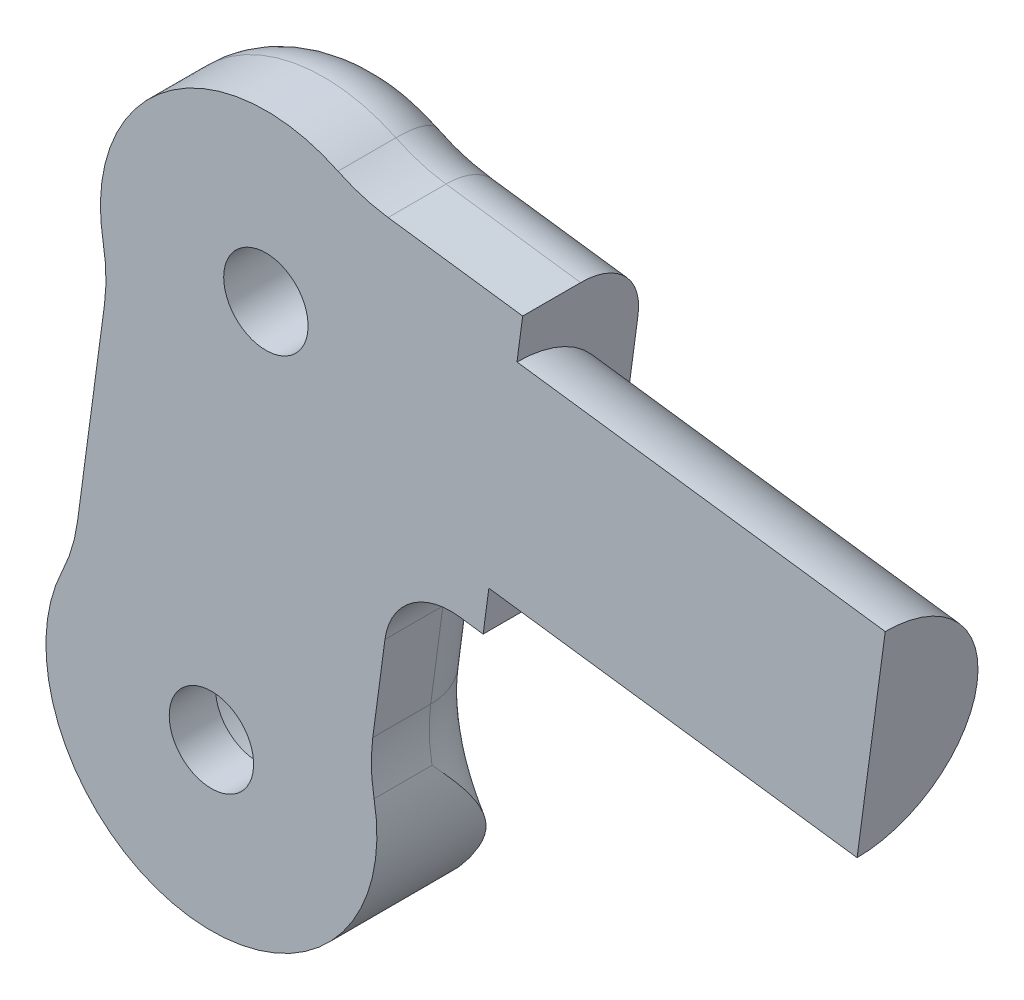
from build123d import *

# Parameters (mm, degrees)
SKETCH_5_R          = 2.549999999999386
SKETCH_5_R_2        = 2.5499999999993856
EXTRUDE_3_DEPTH     = 15
FILLET_4_R          = 4
SKETCH_6_R          = 6.4
EXTRUDE_4_DEPTH     = 22.45
SKETCH_7_R          = 6.500000000000399
CUT_EXTRUDE_1_DEPTH = 4.7
CUT_EXTRUDE_START   = -4.7
SKETCH_8_R          = 6.5000000000004
CUT_EXTRUDE_2_DEPTH = 4.7
SKETCH_9_W          = 7.500000000000001
SKETCH_9_H          = 50
CUT_EXTRUDE_3_DEPTH = 60.93846709540564
CUT_EXTRUDE_4_DEPTH = 1.5


with BuildPart() as part:
    # 草图5 → 凸台-拉伸3 (new body)
    with BuildSketch(Plane.XY):
        with BuildLine():
            Line((15.516814200942974, 7.002212297082977), (7.384422843001557, 8.091371903180063))
            ThreePointArc((7.384422843001557, 8.091371903180063), (5.833974336981676, 8.425935572547054), (4.355928265143314, 9.001438160032777))
            ThreePointArc((4.355928265143314, 9.001438160032777), (-6.069854623087594, 7.9471293467862205), (-9.830420232039064, -1.833804259316535))
            ThreePointArc((-9.830420232039064, -1.833804259316535), (-9.664128327097558, -3.411197812311804), (-9.749336047196284, -4.9950422059047135))
            Line((-9.749336047196284, -4.9950422059047135), (-11.383433357070604, -17.19630156804213))
            ThreePointArc((-11.383433357070604, -17.19630156804213), (-11.717997026437386, -18.74675007406113), (-12.293499613922735, -20.224796145898665))
            ThreePointArc((-12.293499613922735, -20.224796145898665), (-4.619495141172904, -34.49222882793015), (6.538358778190678, -22.74692015173956))
            ThreePointArc((6.538358778190678, -22.74692015173956), (6.372066873248224, -21.169526598736233), (6.457274593312704, -19.585682205136127))
            Line((6.457274593312704, -19.585682205136127), (7.194690181736359, -14.079646060494996))
            ThreePointArc((7.194690181736359, -14.079646060494996), (8.731350099253188, -11.431767796690654), (11.6902654233994, -10.646017768651808))
            Line((11.6902654233994, -10.646017768651808), (13.127433563848712, -10.83849565330608))
            Line((13.127433563848712, -10.83849565330608), (15.516814200942974, 7.002212297082977))
        make_face()
        Circle(SKETCH_5_R, mode=Mode.SUBTRACT)
        with Locations((-3.292061453885612, -24.580724411045196)):
            Circle(SKETCH_5_R_2, mode=Mode.SUBTRACT)
    extrude(amount=EXTRUDE_3_DEPTH)

    # 圆角4
    # the kernel refuses this fillet: 4 mm, written as the material it takes off along each edge
    with BuildSketch(Plane(origin=(-19.660840464079456, -3.667608518633336, 15), x_dir=(0.9830420232040514, 0.18338042593168238, 0), z_dir=(-0.18338042593168238, 0.9830420232040514, 0))) as fillet_4_piece_1:
        with BuildLine():
            CenterArc((9.999999999999877 + FILLET_4_R, FILLET_4_R), FILLET_4_R, 180, 90)
            Line((9.999999999999877 + FILLET_4_R, 0), (9.999999999999877, 0))
            Line((9.999999999999877, 0), (9.999999999999877, FILLET_4_R))
        make_face()
    revolve(axis=Axis((-19.660840464079456, -3.667608518633336, 15), (0, 0, -1)), revolution_arc=18.194872338749263, mode=Mode.SUBTRACT)
    with BuildSketch(Plane(origin=(25.428318617827628, 5.674778609821737, 0), x_dir=(0, 0, 1), z_dir=(-0.9911504416884656, 0.132743368726124, 0))) as fillet_4_piece_2:
        with BuildLine():
            CenterArc((FILLET_4_R, -FILLET_4_R), FILLET_4_R, 90, 90)
            Line((-4.4e-16, -FILLET_4_R), (0, 0))
            Line((0, 0), (FILLET_4_R, 0))
        make_face()
    extrude(amount=18.20500200160084, mode=Mode.SUBTRACT)
    with BuildSketch(Plane(origin=(11.6902654233994, -10.646017768651808, 0), x_dir=(0, 0, 1), z_dir=(0.9911504416883519, -0.13274336872697298, 0))) as fillet_4_piece_3:
        with BuildLine():
            CenterArc((FILLET_4_R, -FILLET_4_R), FILLET_4_R, 90, 90)
            Line((-4.4e-16, -FILLET_4_R), (0, 0))
            Line((0, 0), (FILLET_4_R, 0))
        make_face()
    extrude(amount=11.450000000001213, mode=Mode.SUBTRACT)
    with BuildSketch(Plane(origin=(11.159291948489525, -14.61061953540499, 0), x_dir=(-0.9911504416882816, 0.13274336872749704, 0), z_dir=(-0.13274336872749704, -0.9911504416882816, 0))) as fillet_4_piece_4:
        with BuildLine():
            CenterArc((4.00000000000004 + FILLET_4_R, -FILLET_4_R), FILLET_4_R, 90, 90)
            Line((4.00000000000004 + FILLET_4_R, 4.4e-16), (4.00000000000004, 0))
            Line((4.00000000000004, 0), (4.00000000000004, -FILLET_4_R))
        make_face()
    revolve(axis=Axis((11.159291948489525, -14.61061953540499, 0), (0, 0, -1)), revolution_arc=89.99999999999828, mode=Mode.SUBTRACT)
    with BuildSketch(Plane(origin=(6.457274593312704, -19.585682205136127, 0), x_dir=(0, 0, 1), z_dir=(0.13274336872730183, 0.9911504416883078, 0))) as fillet_4_piece_5:
        with BuildLine():
            CenterArc((FILLET_4_R, -FILLET_4_R), FILLET_4_R, 90, 90)
            Line((-4.4e-16, -FILLET_4_R), (0, 0))
            Line((0, 0), (FILLET_4_R, 0))
        make_face()
    extrude(amount=5.555197186072226, mode=Mode.SUBTRACT)
    with BuildSketch(Plane(origin=(16.3687790116358, -20.91311589226998, 0), x_dir=(-0.3768153606688204, -0.9262883913576953, 0), z_dir=(0.9262883913576953, -0.3768153606688204, 0))) as fillet_4_piece_6:
        with BuildLine():
            CenterArc((10.000000001408804 + FILLET_4_R, -FILLET_4_R), FILLET_4_R, 90, 90)
            Line((10.000000001408804 + FILLET_4_R, 4.4e-16), (10.000000001408804, 0))
            Line((10.000000001408804, 0), (10.000000001408807, -FILLET_4_R))
        make_face()
    revolve(axis=Axis((16.3687790116358, -20.91311589226998, 0), (0, 0, -1)), revolution_arc=75.49159227711695, mode=Mode.SUBTRACT)
    with BuildSketch(Plane(origin=(-9.749336047196284, -4.9950422059047135, 15), x_dir=(0, 0, -1), z_dir=(-0.13274336872713738, -0.9911504416883298, 0))) as fillet_4_piece_7:
        with BuildLine():
            CenterArc((FILLET_4_R, FILLET_4_R), FILLET_4_R, 180, 90)
            Line((0, FILLET_4_R), (0, 0))
            Line((0, 0), (FILLET_4_R, 0))
        make_face()
    extrude(amount=12.310199187677041, mode=Mode.SUBTRACT)
    with BuildSketch(Plane(origin=(-21.29493777395568, -15.868867880738112, 0), x_dir=(0.9911504416879034, -0.132743368730321, 0), z_dir=(0.132743368730321, 0.9911504416879034, 0))) as fillet_4_piece_8:
        with BuildLine():
            CenterArc((10.000000000006096 + FILLET_4_R, -FILLET_4_R), FILLET_4_R, 90, 90)
            Line((10.000000000006096 + FILLET_4_R, 4.4e-16), (10.000000000006096, 0))
            Line((10.000000000006096, 0), (10.000000000006095, -FILLET_4_R))
        make_face()
    revolve(axis=Axis((-21.29493777395568, -15.868867880738112, 0), (0, 0, -1)), revolution_arc=75.49159228762214, mode=Mode.SUBTRACT)
    with BuildSketch(Plane(origin=(-9.749336047196284, -4.9950422059047135, 0), x_dir=(0, 0, 1), z_dir=(-0.13274336872713738, -0.9911504416883298, 0))) as fillet_4_piece_9:
        with BuildLine():
            CenterArc((FILLET_4_R, -FILLET_4_R), FILLET_4_R, 90, 90)
            Line((-4.4e-16, -FILLET_4_R), (0, 0))
            Line((0, 0), (FILLET_4_R, 0))
        make_face()
    extrude(amount=12.310199187677041, mode=Mode.SUBTRACT)
    with BuildSketch(Plane(origin=(-19.660840464079456, -3.667608518633336, 0), x_dir=(0.9830420232040514, 0.18338042593168238, 0), z_dir=(-0.18338042593168238, 0.9830420232040514, 0))) as fillet_4_piece_10:
        with BuildLine():
            CenterArc((9.999999999999877 + FILLET_4_R, -FILLET_4_R), FILLET_4_R, 90, 90)
            Line((9.999999999999877 + FILLET_4_R, 4.4e-16), (9.999999999999877, 0))
            Line((9.999999999999877, 0), (9.999999999999877, -FILLET_4_R))
        make_face()
    revolve(axis=Axis((-19.660840464079456, -3.667608518633336, 0), (0, 0, -1)), revolution_arc=18.194872338749263, mode=Mode.SUBTRACT)
    with BuildSketch(Plane(origin=(1.293e-14, -9.637e-14, 0), x_dir=(0.43559282651439474, 0.900143816003421, 0), z_dir=(0.900143816003421, -0.43559282651439474, 0))) as fillet_4_piece_11:
        with BuildLine():
            CenterArc((9.999999999998517 - FILLET_4_R, FILLET_4_R), FILLET_4_R, 270, 90)
            Line((9.999999999998517 - FILLET_4_R, -4.4e-16), (9.999999999998517, 0))
            Line((9.999999999998517, 0), (9.999999999998517, FILLET_4_R))
        make_face()
    revolve(axis=Axis((1.293e-14, -9.637e-14, 0), (0, 0, 1)), revolution_arc=126.3897446775693, mode=Mode.SUBTRACT)
    with BuildSketch(Plane(origin=(8.711856530306191, 18.0028763200696, 0), x_dir=(-0.13274336873032264, -0.9911504416879031, 0), z_dir=(0.9911504416879031, -0.13274336873032264, 0))) as fillet_4_piece_12:
        with BuildLine():
            CenterArc((10.0000000000106 + FILLET_4_R, -FILLET_4_R), FILLET_4_R, 90.00000000000003, 90)
            Line((10.0000000000106 + FILLET_4_R, 4.4e-16), (10.0000000000106, 0))
            Line((10.0000000000106, 0), (10.0000000000106, -FILLET_4_R))
        make_face()
    revolve(axis=Axis((8.711856530306191, 18.0028763200696, 0), (0, 0, -1)), revolution_arc=18.19487233872778, mode=Mode.SUBTRACT)
    with BuildSketch(Plane(origin=(-21.29493777395568, -15.868867880738112, 15), x_dir=(0.9911504416879034, -0.132743368730321, 0), z_dir=(0.132743368730321, 0.9911504416879034, 0))) as fillet_4_piece_13:
        with BuildLine():
            CenterArc((10.000000000006096 + FILLET_4_R, FILLET_4_R), FILLET_4_R, 180, 90)
            Line((10.000000000006096 + FILLET_4_R, 0), (10.000000000006096, 0))
            Line((10.000000000006096, 0), (10.000000000006095, FILLET_4_R))
        make_face()
    revolve(axis=Axis((-21.29493777395568, -15.868867880738112, 15), (0, 0, -1)), revolution_arc=75.49159228762214, mode=Mode.SUBTRACT)
    with BuildSketch(Plane(origin=(16.3687790116358, -20.91311589226998, 15), x_dir=(-0.3768153606688204, -0.9262883913576953, 0), z_dir=(0.9262883913576953, -0.3768153606688204, 0))) as fillet_4_piece_14:
        with BuildLine():
            CenterArc((10.000000001408804 + FILLET_4_R, FILLET_4_R), FILLET_4_R, 180, 90)
            Line((10.000000001408804 + FILLET_4_R, 0), (10.000000001408804, 0))
            Line((10.000000001408804, 0), (10.000000001408807, FILLET_4_R))
        make_face()
    revolve(axis=Axis((16.3687790116358, -20.91311589226998, 15), (0, 0, -1)), revolution_arc=75.49159227711695, mode=Mode.SUBTRACT)
    with BuildSketch(Plane(origin=(6.457274593312704, -19.585682205136127, 15), x_dir=(0, 0, -1), z_dir=(0.13274336872730183, 0.9911504416883078, 0))) as fillet_4_piece_15:
        with BuildLine():
            CenterArc((FILLET_4_R, FILLET_4_R), FILLET_4_R, 180, 90)
            Line((0, FILLET_4_R), (0, 0))
            Line((0, 0), (FILLET_4_R, 0))
        make_face()
    extrude(amount=5.555197186072226, mode=Mode.SUBTRACT)
    with BuildSketch(Plane(origin=(11.159291948489525, -14.61061953540499, 15), x_dir=(-0.9911504416882816, 0.13274336872749704, 0), z_dir=(-0.13274336872749704, -0.9911504416882816, 0))) as fillet_4_piece_16:
        with BuildLine():
            CenterArc((4.00000000000004 + FILLET_4_R, FILLET_4_R), FILLET_4_R, 180, 90)
            Line((4.00000000000004 + FILLET_4_R, 0), (4.00000000000004, 0))
            Line((4.00000000000004, 0), (4.00000000000004, FILLET_4_R))
        make_face()
    revolve(axis=Axis((11.159291948489525, -14.61061953540499, 15), (0, 0, -1)), revolution_arc=89.99999999999828, mode=Mode.SUBTRACT)
    with BuildSketch(Plane(origin=(11.6902654233994, -10.646017768651808, 15), x_dir=(0, 0, -1), z_dir=(0.9911504416883519, -0.13274336872697298, 0))) as fillet_4_piece_17:
        with BuildLine():
            CenterArc((FILLET_4_R, FILLET_4_R), FILLET_4_R, 180, 90)
            Line((0, FILLET_4_R), (0, 0))
            Line((0, 0), (FILLET_4_R, 0))
        make_face()
    extrude(amount=11.450000000001213, mode=Mode.SUBTRACT)
    with BuildSketch(Plane(origin=(25.428318617827628, 5.674778609821737, 15), x_dir=(0, 0, -1), z_dir=(-0.9911504416884656, 0.132743368726124, 0))) as fillet_4_piece_18:
        with BuildLine():
            CenterArc((FILLET_4_R, FILLET_4_R), FILLET_4_R, 180, 90)
            Line((0, FILLET_4_R), (0, 0))
            Line((0, 0), (FILLET_4_R, 0))
        make_face()
    extrude(amount=18.20500200160084, mode=Mode.SUBTRACT)
    with BuildSketch(Plane(origin=(8.711856530306191, 18.0028763200696, 15), x_dir=(-0.13274336873032264, -0.9911504416879031, 0), z_dir=(0.9911504416879031, -0.13274336873032264, 0))) as fillet_4_piece_19:
        with BuildLine():
            CenterArc((10.0000000000106 + FILLET_4_R, FILLET_4_R), FILLET_4_R, 180, 90)
            Line((10.0000000000106 + FILLET_4_R, 0), (10.0000000000106, 0))
            Line((10.0000000000106, 0), (10.0000000000106, FILLET_4_R))
        make_face()
    revolve(axis=Axis((8.711856530306191, 18.0028763200696, 15), (0, 0, -1)), revolution_arc=18.19487233872778, mode=Mode.SUBTRACT)
    with BuildSketch(Plane(origin=(1.293e-14, -9.637e-14, 15), x_dir=(0.43559282651439474, 0.900143816003421, 0), z_dir=(0.900143816003421, -0.43559282651439474, 0))) as fillet_4_piece_20:
        with BuildLine():
            CenterArc((9.999999999998517 - FILLET_4_R, -FILLET_4_R), FILLET_4_R, 0, 90)
            Line((9.999999999998517 - FILLET_4_R, 0), (9.999999999998517, 0))
            Line((9.999999999998517, 0), (9.999999999998517, -FILLET_4_R))
        make_face()
    revolve(axis=Axis((1.293e-14, -9.637e-14, 15), (0, 0, 1)), revolution_arc=126.3897446775693, mode=Mode.SUBTRACT)

    # 草图6 → 凸台-拉伸4 (add)
    with BuildSketch(Plane(origin=(14.322123882395811, -1.918141678111804, 0), x_dir=(0, 0, -1), z_dir=(0.9911504416882867, -0.13274336872745984, 0))):
        with Locations(Location((-7.5, 2.047e-13, 0), (0, 0, 270))):
            Circle(SKETCH_6_R)
    extrude(amount=EXTRUDE_4_DEPTH)

    # 草图7 → 切除-拉伸1 (cut)
    with BuildSketch(Plane.XY.offset(15)):
        with Locations((-3.292061453885612, -24.580724411045196)):
            Circle(SKETCH_7_R)
    extrude(amount=-CUT_EXTRUDE_1_DEPTH, mode=Mode.SUBTRACT)

    # 草图8 → 切除-拉伸2 (cut)
    with BuildSketch(Plane(origin=(0, 0, 0), x_dir=(-1, 0, 0), z_dir=(0, 0, -1)).offset(CUT_EXTRUDE_START)):
        with Locations(Location((3.292061453885612, -24.580724411045196, 0), (0, 0, 180))):
            Circle(SKETCH_8_R)
    extrude(amount=CUT_EXTRUDE_2_DEPTH, mode=Mode.SUBTRACT)

    # 草图9 → 切除-拉伸3 (cut, through all)
    with BuildSketch(Plane(origin=(36.57345129829708, -4.898230306043175, 0), x_dir=(0, 0, -1), z_dir=(0.9911504416882867, -0.13274336872745987, 0))):
        with Locations((-11.250000000000002, -9.800195184490525)):
            Rectangle(SKETCH_9_W, SKETCH_9_H)
    extrude(amount=-CUT_EXTRUDE_3_DEPTH, mode=Mode.SUBTRACT)

    # 草图10 → 切除-拉伸4 (cut)
    with BuildSketch(Plane(origin=(0, 0, 0), x_dir=(-1, 0, 0), z_dir=(0, 0, -1))):
        Polygon((2.0207259421636907, -3.5), (4.041451884327381, 2.9e-16), (2.020725942163689, 3.5), (-2.0207259421636903, 3.4999999999999996), (-4.04145188432738, 0), (-2.020725942163687, -3.500000000000001), align=None)
    extrude(amount=-CUT_EXTRUDE_4_DEPTH, mode=Mode.SUBTRACT)


solid = part.part
